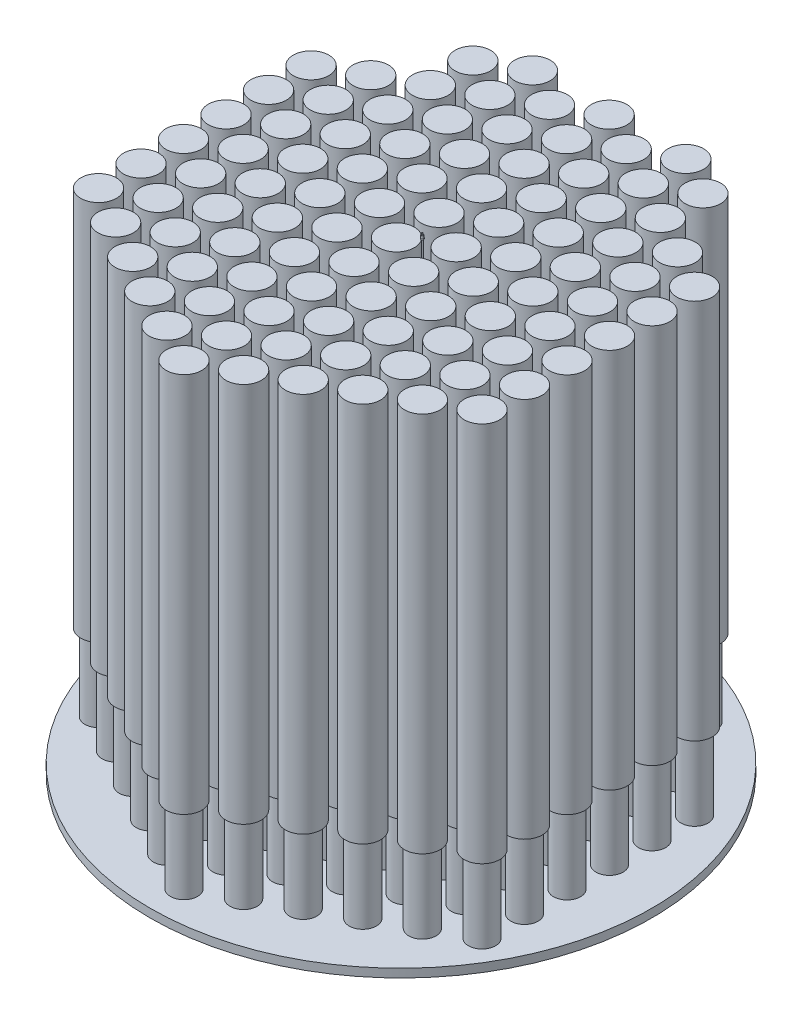
from build123d import *

# Parameters (mm, degrees)
SKETCH1_R                = 46.99
SKETCH1_R_2              = 2.54
BOSS_EXTRUDE3_DEPTH      = 1.5875
BOSS_EXTRUDE4_DEPTH      = 14.3891
BOSS_EXTRUDE4_DEPTH_BACK = 1.5875
SKETCH1_3_R              = 2.54
FILL_PATTERN11_OUTLINE_R = 2.54
FILL_PATTERN11_DEPTH     = 14.3891
SKETCH2_R                = 3.33375
BOSS_EXTRUDE5_DEPTH      = 71.330853706
FILL_START               = 14.3891
FILL_PATTERN13_OUTLINE_R = 3.33375
FILL_PATTERN13_DEPTH     = 71.330853706
SKETCH10_R               = 0.13170027
BOSS_EXTRUDE8_DEPTH      = 74.676
SKETCH13_R               = 0.13170027
BOSS_EXTRUDE12_DEPTH     = 0.04572
SKETCH14_R               = 0.166234784
BOSS_EXTRUDE13_DEPTH     = 0.04572
SKETCH15_R               = 0.195430412
BOSS_EXTRUDE14_DEPTH     = 0.1016
SKETCH16_R               = 0.262147885
BOSS_EXTRUDE15_DEPTH     = 0.2286
SKETCH20_R               = 0.22704795
BOSS_EXTRUDE16_DEPTH     = 0.4064
SKETCH21_R               = 0.190832989
CUT_EXTRUDE5_DEPTH       = 0.1524
SKETCH22_R               = 0.143150147
BOSS_EXTRUDE17_DEPTH     = 0.254
SKETCH23_R               = 0.10901546
CUT_EXTRUDE6_DEPTH       = 0.2286
SKETCH24_R               = 0.08006779
BOSS_EXTRUDE18_DEPTH     = 0.508


# Read off the part's stored shape, not the designer's step: Fill Pattern11, Fill Pattern13
with BuildPart() as part:
    # Sketch1 → Boss-Extrude3 (new body)
    with BuildSketch(Plane(origin=(0, 0, 0), x_dir=(1, 0, 0), z_dir=(0, 1, 0))):
        with Locations(Location((0, 0, 0), (0, 0, 270))):
            Circle(SKETCH1_R)
        with Locations(Location((0, -40.64, 0), (0, 0, 270))):
            Circle(SKETCH1_R_2, mode=Mode.SUBTRACT)
    extrude(amount=-BOSS_EXTRUDE3_DEPTH)

    # Sketch1<3> → Boss-Extrude4 (add, two sides: drawn at the far end of the back side and taken through both)
    with BuildSketch(Plane(origin=(0, 0, 0), x_dir=(1, 0, 0), z_dir=(0, 1, 0)).offset(-BOSS_EXTRUDE4_DEPTH_BACK)):
        with Locations(Location((0, -40.64, 0), (0, 0, 270))):
            Circle(SKETCH1_3_R)
    extrude(amount=BOSS_EXTRUDE4_DEPTH + BOSS_EXTRUDE4_DEPTH_BACK)

    # Fill Pattern11 outline → Fill Pattern11 (add)
    with BuildSketch(Plane(origin=(0, 0, 0), x_dir=(1, 0, 0), z_dir=(0, 1, 0))):
        with Locations((-7.181309219, -36.659335299)):
            Circle(FILL_PATTERN11_OUTLINE_R)
        with Locations((-14.362618438, -32.678670597)):
            Circle(FILL_PATTERN11_OUTLINE_R)
        with Locations((-21.543927656, -28.698005896)):
            Circle(FILL_PATTERN11_OUTLINE_R)
        with Locations((-28.725236875, -24.717341195)):
            Circle(FILL_PATTERN11_OUTLINE_R)
        with Locations((-35.906546094, -20.736676494)):
            Circle(FILL_PATTERN11_OUTLINE_R)
        with Locations((7.181309219, -36.659335299)):
            Circle(FILL_PATTERN11_OUTLINE_R)
        with Locations((0, -32.678670597)):
            Circle(FILL_PATTERN11_OUTLINE_R)
        with Locations((-7.181309219, -28.698005896)):
            Circle(FILL_PATTERN11_OUTLINE_R)
        with Locations((-14.362618438, -24.717341195)):
            Circle(FILL_PATTERN11_OUTLINE_R)
        with Locations((-21.543927656, -20.736676494)):
            Circle(FILL_PATTERN11_OUTLINE_R)
        with Locations((-28.725236875, -16.756011792)):
            Circle(FILL_PATTERN11_OUTLINE_R)
        with Locations((-35.906546094, -12.775347091)):
            Circle(FILL_PATTERN11_OUTLINE_R)
        with Locations((14.362618438, -32.678670597)):
            Circle(FILL_PATTERN11_OUTLINE_R)
        with Locations((7.181309219, -28.698005896)):
            Circle(FILL_PATTERN11_OUTLINE_R)
        with Locations((0, -24.717341195)):
            Circle(FILL_PATTERN11_OUTLINE_R)
        with Locations((-7.181309219, -20.736676494)):
            Circle(FILL_PATTERN11_OUTLINE_R)
        with Locations((-14.362618438, -16.756011792)):
            Circle(FILL_PATTERN11_OUTLINE_R)
        with Locations((-21.543927656, -12.775347091)):
            Circle(FILL_PATTERN11_OUTLINE_R)
        with Locations((-28.725236875, -8.79468239)):
            Circle(FILL_PATTERN11_OUTLINE_R)
        with Locations((-35.906546094, -4.814017689)):
            Circle(FILL_PATTERN11_OUTLINE_R)
        with Locations((21.543927656, -28.698005896)):
            Circle(FILL_PATTERN11_OUTLINE_R)
        with Locations((14.362618438, -24.717341195)):
            Circle(FILL_PATTERN11_OUTLINE_R)
        with Locations((7.181309219, -20.736676494)):
            Circle(FILL_PATTERN11_OUTLINE_R)
        with Locations((0, -16.756011792)):
            Circle(FILL_PATTERN11_OUTLINE_R)
        with Locations((-7.181309219, -12.775347091)):
            Circle(FILL_PATTERN11_OUTLINE_R)
        with Locations((-14.362618438, -8.79468239)):
            Circle(FILL_PATTERN11_OUTLINE_R)
        with Locations((-21.543927656, -4.814017689)):
            Circle(FILL_PATTERN11_OUTLINE_R)
        with Locations((-28.725236875, -0.833352987)):
            Circle(FILL_PATTERN11_OUTLINE_R)
        with Locations((-35.906546094, 3.147311714)):
            Circle(FILL_PATTERN11_OUTLINE_R)
        with Locations((28.725236875, -24.717341195)):
            Circle(FILL_PATTERN11_OUTLINE_R)
        with Locations((21.543927656, -20.736676494)):
            Circle(FILL_PATTERN11_OUTLINE_R)
        with Locations((14.362618438, -16.756011792)):
            Circle(FILL_PATTERN11_OUTLINE_R)
        with Locations((7.181309219, -12.775347091)):
            Circle(FILL_PATTERN11_OUTLINE_R)
        with Locations((0, -8.79468239)):
            Circle(FILL_PATTERN11_OUTLINE_R)
        with Locations((-7.181309219, -4.814017689)):
            Circle(FILL_PATTERN11_OUTLINE_R)
        with Locations((-14.362618438, -0.833352987)):
            Circle(FILL_PATTERN11_OUTLINE_R)
        with Locations((-21.543927656, 3.147311714)):
            Circle(FILL_PATTERN11_OUTLINE_R)
        with Locations((-28.725236875, 7.127976415)):
            Circle(FILL_PATTERN11_OUTLINE_R)
        with Locations((-35.906546094, 11.108641117)):
            Circle(FILL_PATTERN11_OUTLINE_R)
        with Locations((35.906546094, -20.736676494)):
            Circle(FILL_PATTERN11_OUTLINE_R)
        with Locations((28.725236875, -16.756011792)):
            Circle(FILL_PATTERN11_OUTLINE_R)
        with Locations((21.543927656, -12.775347091)):
            Circle(FILL_PATTERN11_OUTLINE_R)
        with Locations((14.362618438, -8.79468239)):
            Circle(FILL_PATTERN11_OUTLINE_R)
        with Locations((7.181309219, -4.814017689)):
            Circle(FILL_PATTERN11_OUTLINE_R)
        with Locations((0, -0.833352987)):
            Circle(FILL_PATTERN11_OUTLINE_R)
        with Locations((-7.181309219, 3.147311714)):
            Circle(FILL_PATTERN11_OUTLINE_R)
        with Locations((-14.362618438, 7.127976415)):
            Circle(FILL_PATTERN11_OUTLINE_R)
        with Locations((-21.543927656, 11.108641117)):
            Circle(FILL_PATTERN11_OUTLINE_R)
        with Locations((-28.725236875, 15.089305818)):
            Circle(FILL_PATTERN11_OUTLINE_R)
        with Locations((-35.906546094, 19.069970519)):
            Circle(FILL_PATTERN11_OUTLINE_R)
        with Locations((35.906546094, -12.775347091)):
            Circle(FILL_PATTERN11_OUTLINE_R)
        with Locations((28.725236875, -8.79468239)):
            Circle(FILL_PATTERN11_OUTLINE_R)
        with Locations((21.543927656, -4.814017689)):
            Circle(FILL_PATTERN11_OUTLINE_R)
        with Locations((14.362618438, -0.833352987)):
            Circle(FILL_PATTERN11_OUTLINE_R)
        with Locations((7.181309219, 3.147311714)):
            Circle(FILL_PATTERN11_OUTLINE_R)
        with Locations((0, 7.127976415)):
            Circle(FILL_PATTERN11_OUTLINE_R)
        with Locations((-7.181309219, 11.108641117)):
            Circle(FILL_PATTERN11_OUTLINE_R)
        with Locations((-14.362618438, 15.089305818)):
            Circle(FILL_PATTERN11_OUTLINE_R)
        with Locations((-21.543927656, 19.069970519)):
            Circle(FILL_PATTERN11_OUTLINE_R)
        with Locations((-28.725236875, 23.05063522)):
            Circle(FILL_PATTERN11_OUTLINE_R)
        with Locations((35.906546094, -4.814017689)):
            Circle(FILL_PATTERN11_OUTLINE_R)
        with Locations((28.725236875, -0.833352987)):
            Circle(FILL_PATTERN11_OUTLINE_R)
        with Locations((21.543927656, 3.147311714)):
            Circle(FILL_PATTERN11_OUTLINE_R)
        with Locations((14.362618438, 7.127976415)):
            Circle(FILL_PATTERN11_OUTLINE_R)
        with Locations((7.181309219, 11.108641117)):
            Circle(FILL_PATTERN11_OUTLINE_R)
        with Locations((0, 15.089305818)):
            Circle(FILL_PATTERN11_OUTLINE_R)
        with Locations((-7.181309219, 19.069970519)):
            Circle(FILL_PATTERN11_OUTLINE_R)
        with Locations((-14.362618438, 23.05063522)):
            Circle(FILL_PATTERN11_OUTLINE_R)
        with Locations((-21.543927656, 27.031299922)):
            Circle(FILL_PATTERN11_OUTLINE_R)
        with Locations((35.906546094, 3.147311714)):
            Circle(FILL_PATTERN11_OUTLINE_R)
        with Locations((28.725236875, 7.127976415)):
            Circle(FILL_PATTERN11_OUTLINE_R)
        with Locations((21.543927656, 11.108641117)):
            Circle(FILL_PATTERN11_OUTLINE_R)
        with Locations((14.362618438, 15.089305818)):
            Circle(FILL_PATTERN11_OUTLINE_R)
        with Locations((7.181309219, 19.069970519)):
            Circle(FILL_PATTERN11_OUTLINE_R)
        with Locations((0, 23.05063522)):
            Circle(FILL_PATTERN11_OUTLINE_R)
        with Locations((-7.181309219, 27.031299922)):
            Circle(FILL_PATTERN11_OUTLINE_R)
        with Locations((-14.362618438, 31.011964623)):
            Circle(FILL_PATTERN11_OUTLINE_R)
        with Locations((-21.543927656, 34.992629324)):
            Circle(FILL_PATTERN11_OUTLINE_R)
        with Locations((35.906546094, 11.108641117)):
            Circle(FILL_PATTERN11_OUTLINE_R)
        with Locations((28.725236875, 15.089305818)):
            Circle(FILL_PATTERN11_OUTLINE_R)
        with Locations((21.543927656, 19.069970519)):
            Circle(FILL_PATTERN11_OUTLINE_R)
        with Locations((14.362618438, 23.05063522)):
            Circle(FILL_PATTERN11_OUTLINE_R)
        with Locations((7.181309219, 27.031299922)):
            Circle(FILL_PATTERN11_OUTLINE_R)
        with Locations((0, 31.011964623)):
            Circle(FILL_PATTERN11_OUTLINE_R)
        with Locations((-7.181309219, 34.992629324)):
            Circle(FILL_PATTERN11_OUTLINE_R)
        with Locations((-14.362618438, 38.973294026)):
            Circle(FILL_PATTERN11_OUTLINE_R)
        with Locations((35.906546094, 19.069970519)):
            Circle(FILL_PATTERN11_OUTLINE_R)
        with Locations((28.725236875, 23.05063522)):
            Circle(FILL_PATTERN11_OUTLINE_R)
        with Locations((21.543927656, 27.031299922)):
            Circle(FILL_PATTERN11_OUTLINE_R)
        with Locations((14.362618438, 31.011964623)):
            Circle(FILL_PATTERN11_OUTLINE_R)
        with Locations((7.181309219, 34.992629324)):
            Circle(FILL_PATTERN11_OUTLINE_R)
        with Locations((0, 38.973294026)):
            Circle(FILL_PATTERN11_OUTLINE_R)
        with Locations((21.543927656, 34.992629324)):
            Circle(FILL_PATTERN11_OUTLINE_R)
        with Locations((14.362618438, 38.973294026)):
            Circle(FILL_PATTERN11_OUTLINE_R)
    extrude(amount=FILL_PATTERN11_DEPTH)

    # Sketch2 → Boss-Extrude5 (add)
    with BuildSketch(Plane(origin=(0, 14.3891, 0), x_dir=(1, 0, 0), z_dir=(0, 1, 0))):
        with Locations(Location((0, -40.64, 0), (0, 0, 270))):
            Circle(SKETCH2_R)
    extrude(amount=BOSS_EXTRUDE5_DEPTH)

    # Fill Pattern13 outline → Fill Pattern13 (add)
    with BuildSketch(Plane(origin=(0, 0, 0), x_dir=(1, 0, 0), z_dir=(0, 1, 0)).offset(FILL_START)):
        with Locations((7.181309219, -36.659335299)):
            Circle(FILL_PATTERN13_OUTLINE_R)
        with Locations((14.362618438, -32.678670597)):
            Circle(FILL_PATTERN13_OUTLINE_R)
        with Locations((21.543927656, -28.698005896)):
            Circle(FILL_PATTERN13_OUTLINE_R)
        with Locations((28.725236875, -24.717341195)):
            Circle(FILL_PATTERN13_OUTLINE_R)
        with Locations((35.906546094, -20.736676494)):
            Circle(FILL_PATTERN13_OUTLINE_R)
        with Locations((-7.181309219, -36.659335299)):
            Circle(FILL_PATTERN13_OUTLINE_R)
        with Locations((0, -32.678670597)):
            Circle(FILL_PATTERN13_OUTLINE_R)
        with Locations((7.181309219, -28.698005896)):
            Circle(FILL_PATTERN13_OUTLINE_R)
        with Locations((14.362618438, -24.717341195)):
            Circle(FILL_PATTERN13_OUTLINE_R)
        with Locations((21.543927656, -20.736676494)):
            Circle(FILL_PATTERN13_OUTLINE_R)
        with Locations((28.725236875, -16.756011792)):
            Circle(FILL_PATTERN13_OUTLINE_R)
        with Locations((35.906546094, -12.775347091)):
            Circle(FILL_PATTERN13_OUTLINE_R)
        with Locations((-14.362618438, -32.678670597)):
            Circle(FILL_PATTERN13_OUTLINE_R)
        with Locations((-7.181309219, -28.698005896)):
            Circle(FILL_PATTERN13_OUTLINE_R)
        with Locations((0, -24.717341195)):
            Circle(FILL_PATTERN13_OUTLINE_R)
        with Locations((7.181309219, -20.736676494)):
            Circle(FILL_PATTERN13_OUTLINE_R)
        with Locations((14.362618438, -16.756011792)):
            Circle(FILL_PATTERN13_OUTLINE_R)
        with Locations((21.543927656, -12.775347091)):
            Circle(FILL_PATTERN13_OUTLINE_R)
        with Locations((28.725236875, -8.79468239)):
            Circle(FILL_PATTERN13_OUTLINE_R)
        with Locations((35.906546094, -4.814017689)):
            Circle(FILL_PATTERN13_OUTLINE_R)
        with Locations((-21.543927656, -28.698005896)):
            Circle(FILL_PATTERN13_OUTLINE_R)
        with Locations((-14.362618438, -24.717341195)):
            Circle(FILL_PATTERN13_OUTLINE_R)
        with Locations((-7.181309219, -20.736676494)):
            Circle(FILL_PATTERN13_OUTLINE_R)
        with Locations((0, -16.756011792)):
            Circle(FILL_PATTERN13_OUTLINE_R)
        with Locations((7.181309219, -12.775347091)):
            Circle(FILL_PATTERN13_OUTLINE_R)
        with Locations((14.362618438, -8.79468239)):
            Circle(FILL_PATTERN13_OUTLINE_R)
        with Locations((21.543927656, -4.814017689)):
            Circle(FILL_PATTERN13_OUTLINE_R)
        with Locations((28.725236875, -0.833352987)):
            Circle(FILL_PATTERN13_OUTLINE_R)
        with Locations((35.906546094, 3.147311714)):
            Circle(FILL_PATTERN13_OUTLINE_R)
        with Locations((-28.725236875, -24.717341195)):
            Circle(FILL_PATTERN13_OUTLINE_R)
        with Locations((-21.543927656, -20.736676494)):
            Circle(FILL_PATTERN13_OUTLINE_R)
        with Locations((-14.362618438, -16.756011792)):
            Circle(FILL_PATTERN13_OUTLINE_R)
        with Locations((-7.181309219, -12.775347091)):
            Circle(FILL_PATTERN13_OUTLINE_R)
        with Locations((0, -8.79468239)):
            Circle(FILL_PATTERN13_OUTLINE_R)
        with Locations((7.181309219, -4.814017689)):
            Circle(FILL_PATTERN13_OUTLINE_R)
        with Locations((14.362618438, -0.833352987)):
            Circle(FILL_PATTERN13_OUTLINE_R)
        with Locations((21.543927656, 3.147311714)):
            Circle(FILL_PATTERN13_OUTLINE_R)
        with Locations((28.725236875, 7.127976415)):
            Circle(FILL_PATTERN13_OUTLINE_R)
        with Locations((35.906546094, 11.108641117)):
            Circle(FILL_PATTERN13_OUTLINE_R)
        with Locations((-35.906546094, -20.736676494)):
            Circle(FILL_PATTERN13_OUTLINE_R)
        with Locations((-28.725236875, -16.756011792)):
            Circle(FILL_PATTERN13_OUTLINE_R)
        with Locations((-21.543927656, -12.775347091)):
            Circle(FILL_PATTERN13_OUTLINE_R)
        with Locations((-14.362618438, -8.79468239)):
            Circle(FILL_PATTERN13_OUTLINE_R)
        with Locations((-7.181309219, -4.814017689)):
            Circle(FILL_PATTERN13_OUTLINE_R)
        with Locations((0, -0.833352987)):
            Circle(FILL_PATTERN13_OUTLINE_R)
        with Locations((7.181309219, 3.147311714)):
            Circle(FILL_PATTERN13_OUTLINE_R)
        with Locations((14.362618438, 7.127976415)):
            Circle(FILL_PATTERN13_OUTLINE_R)
        with Locations((21.543927656, 11.108641117)):
            Circle(FILL_PATTERN13_OUTLINE_R)
        with Locations((28.725236875, 15.089305818)):
            Circle(FILL_PATTERN13_OUTLINE_R)
        with Locations((35.906546094, 19.069970519)):
            Circle(FILL_PATTERN13_OUTLINE_R)
        with Locations((-35.906546094, -12.775347091)):
            Circle(FILL_PATTERN13_OUTLINE_R)
        with Locations((-28.725236875, -8.79468239)):
            Circle(FILL_PATTERN13_OUTLINE_R)
        with Locations((-21.543927656, -4.814017689)):
            Circle(FILL_PATTERN13_OUTLINE_R)
        with Locations((-14.362618438, -0.833352987)):
            Circle(FILL_PATTERN13_OUTLINE_R)
        with Locations((-7.181309219, 3.147311714)):
            Circle(FILL_PATTERN13_OUTLINE_R)
        with Locations((0, 7.127976415)):
            Circle(FILL_PATTERN13_OUTLINE_R)
        with Locations((7.181309219, 11.108641117)):
            Circle(FILL_PATTERN13_OUTLINE_R)
        with Locations((14.362618438, 15.089305818)):
            Circle(FILL_PATTERN13_OUTLINE_R)
        with Locations((21.543927656, 19.069970519)):
            Circle(FILL_PATTERN13_OUTLINE_R)
        with Locations((28.725236875, 23.05063522)):
            Circle(FILL_PATTERN13_OUTLINE_R)
        with Locations((-35.906546094, -4.814017689)):
            Circle(FILL_PATTERN13_OUTLINE_R)
        with Locations((-28.725236875, -0.833352987)):
            Circle(FILL_PATTERN13_OUTLINE_R)
        with Locations((-21.543927656, 3.147311714)):
            Circle(FILL_PATTERN13_OUTLINE_R)
        with Locations((-14.362618438, 7.127976415)):
            Circle(FILL_PATTERN13_OUTLINE_R)
        with Locations((-7.181309219, 11.108641117)):
            Circle(FILL_PATTERN13_OUTLINE_R)
        with Locations((0, 15.089305818)):
            Circle(FILL_PATTERN13_OUTLINE_R)
        with Locations((7.181309219, 19.069970519)):
            Circle(FILL_PATTERN13_OUTLINE_R)
        with Locations((14.362618438, 23.05063522)):
            Circle(FILL_PATTERN13_OUTLINE_R)
        with Locations((21.543927656, 27.031299922)):
            Circle(FILL_PATTERN13_OUTLINE_R)
        with Locations((-35.906546094, 3.147311714)):
            Circle(FILL_PATTERN13_OUTLINE_R)
        with Locations((-28.725236875, 7.127976415)):
            Circle(FILL_PATTERN13_OUTLINE_R)
        with Locations((-21.543927656, 11.108641117)):
            Circle(FILL_PATTERN13_OUTLINE_R)
        with Locations((-14.362618438, 15.089305818)):
            Circle(FILL_PATTERN13_OUTLINE_R)
        with Locations((-7.181309219, 19.069970519)):
            Circle(FILL_PATTERN13_OUTLINE_R)
        with Locations((0, 23.05063522)):
            Circle(FILL_PATTERN13_OUTLINE_R)
        with Locations((7.181309219, 27.031299922)):
            Circle(FILL_PATTERN13_OUTLINE_R)
        with Locations((14.362618438, 31.011964623)):
            Circle(FILL_PATTERN13_OUTLINE_R)
        with Locations((21.543927656, 34.992629324)):
            Circle(FILL_PATTERN13_OUTLINE_R)
        with Locations((-35.906546094, 11.108641117)):
            Circle(FILL_PATTERN13_OUTLINE_R)
        with Locations((-28.725236875, 15.089305818)):
            Circle(FILL_PATTERN13_OUTLINE_R)
        with Locations((-21.543927656, 19.069970519)):
            Circle(FILL_PATTERN13_OUTLINE_R)
        with Locations((-14.362618438, 23.05063522)):
            Circle(FILL_PATTERN13_OUTLINE_R)
        with Locations((-7.181309219, 27.031299922)):
            Circle(FILL_PATTERN13_OUTLINE_R)
        with Locations((0, 31.011964623)):
            Circle(FILL_PATTERN13_OUTLINE_R)
        with Locations((7.181309219, 34.992629324)):
            Circle(FILL_PATTERN13_OUTLINE_R)
        with Locations((14.362618438, 38.973294026)):
            Circle(FILL_PATTERN13_OUTLINE_R)
        with Locations((-35.906546094, 19.069970519)):
            Circle(FILL_PATTERN13_OUTLINE_R)
        with Locations((-28.725236875, 23.05063522)):
            Circle(FILL_PATTERN13_OUTLINE_R)
        with Locations((-21.543927656, 27.031299922)):
            Circle(FILL_PATTERN13_OUTLINE_R)
        with Locations((-14.362618438, 31.011964623)):
            Circle(FILL_PATTERN13_OUTLINE_R)
        with Locations((-7.181309219, 34.992629324)):
            Circle(FILL_PATTERN13_OUTLINE_R)
        with Locations((0, 38.973294026)):
            Circle(FILL_PATTERN13_OUTLINE_R)
        with Locations((-21.543927656, 34.992629324)):
            Circle(FILL_PATTERN13_OUTLINE_R)
        with Locations((-14.362618438, 38.973294026)):
            Circle(FILL_PATTERN13_OUTLINE_R)
    extrude(amount=FILL_PATTERN13_DEPTH)


with BuildPart() as body_2:
    # Sketch10 → Boss-Extrude8 (new body)
    with BuildSketch(Plane(origin=(0, 85.719953706, 0), x_dir=(1, 0, 0), z_dir=(0, 1, 0))):
        with Locations(Location((2.848371946, 1.140506893, 0), (0, 0, 270))):
            Circle(SKETCH10_R)
    extrude(amount=-BOSS_EXTRUDE8_DEPTH)

    # Sketch13 → Boss-Extrude12 (add)
    with BuildSketch(Plane(origin=(0, 85.719953706, 0), x_dir=(1, 0, 0), z_dir=(0, 1, 0))):
        with Locations(Location((2.848371946, 1.140506893, 0), (0, 0, 270))):
            Circle(SKETCH13_R)
    extrude(amount=BOSS_EXTRUDE12_DEPTH)

    # Sketch14 → Boss-Extrude13 (add)
    with BuildSketch(Plane(origin=(0, 85.765673706, 0), x_dir=(1, 0, 0), z_dir=(0, 1, 0))):
        with Locations(Location((2.848371946, 1.140506893, 0), (0, 0, 270))):
            Circle(SKETCH14_R)
    extrude(amount=BOSS_EXTRUDE13_DEPTH)

    # Sketch15 → Boss-Extrude14 (add)
    with BuildSketch(Plane(origin=(0, 85.811393706, 0), x_dir=(1, 0, 0), z_dir=(0, 1, 0))):
        with Locations(Location((2.848371946, 1.140506893, 0), (0, 0, 270))):
            Circle(SKETCH15_R)
    extrude(amount=BOSS_EXTRUDE14_DEPTH)

    # Sketch16 → Boss-Extrude15 (add)
    with BuildSketch(Plane(origin=(0, 85.912993706, 0), x_dir=(1, 0, 0), z_dir=(0, 1, 0))):
        with Locations(Location((2.848371946, 1.140506893, 0), (0, 0, 270))):
            Circle(SKETCH16_R)
    extrude(amount=BOSS_EXTRUDE15_DEPTH)

    # Sketch20 → Boss-Extrude16 (add)
    with BuildSketch(Plane(origin=(0, 86.141593706, 0), x_dir=(1, 0, 0), z_dir=(0, 1, 0))):
        with Locations(Location((2.848371946, 1.140506893, 0), (0, 0, 270))):
            Circle(SKETCH20_R)
    extrude(amount=BOSS_EXTRUDE16_DEPTH)

    # Sketch21 → Cut-Extrude5 (cut)
    with BuildSketch(Plane(origin=(0, 86.547993706, 0), x_dir=(1, 0, 0), z_dir=(0, 1, 0))):
        with Locations(Location((2.848371946, 1.140506893, 0), (0, 0, 270))):
            Circle(SKETCH21_R)
    extrude(amount=-CUT_EXTRUDE5_DEPTH, mode=Mode.SUBTRACT)

    # Sketch22 → Boss-Extrude17 (add)
    with BuildSketch(Plane(origin=(0, 86.395593706, 0), x_dir=(1, 0, 0), z_dir=(0, 1, 0))):
        with Locations(Location((2.848371946, 1.140506893, 0), (0, 0, 270))):
            Circle(SKETCH22_R)
    extrude(amount=BOSS_EXTRUDE17_DEPTH)

    # Sketch23 → Cut-Extrude6 (cut)
    with BuildSketch(Plane(origin=(0, 86.649593706, 0), x_dir=(1, 0, 0), z_dir=(0, 1, 0))):
        with Locations(Location((2.848371946, 1.140506893, 0), (0, 0, 270))):
            Circle(SKETCH23_R)
    extrude(amount=-CUT_EXTRUDE6_DEPTH, mode=Mode.SUBTRACT)

    # Sketch24 → Boss-Extrude18 (add)
    with BuildSketch(Plane(origin=(0, 86.420993706, 0), x_dir=(1, 0, 0), z_dir=(0, 1, 0))):
        with Locations(Location((2.848371946, 1.140506893, 0), (0, 0, 270))):
            Circle(SKETCH24_R)
    extrude(amount=BOSS_EXTRUDE18_DEPTH)


solid = Compound([part.part, body_2.part])
